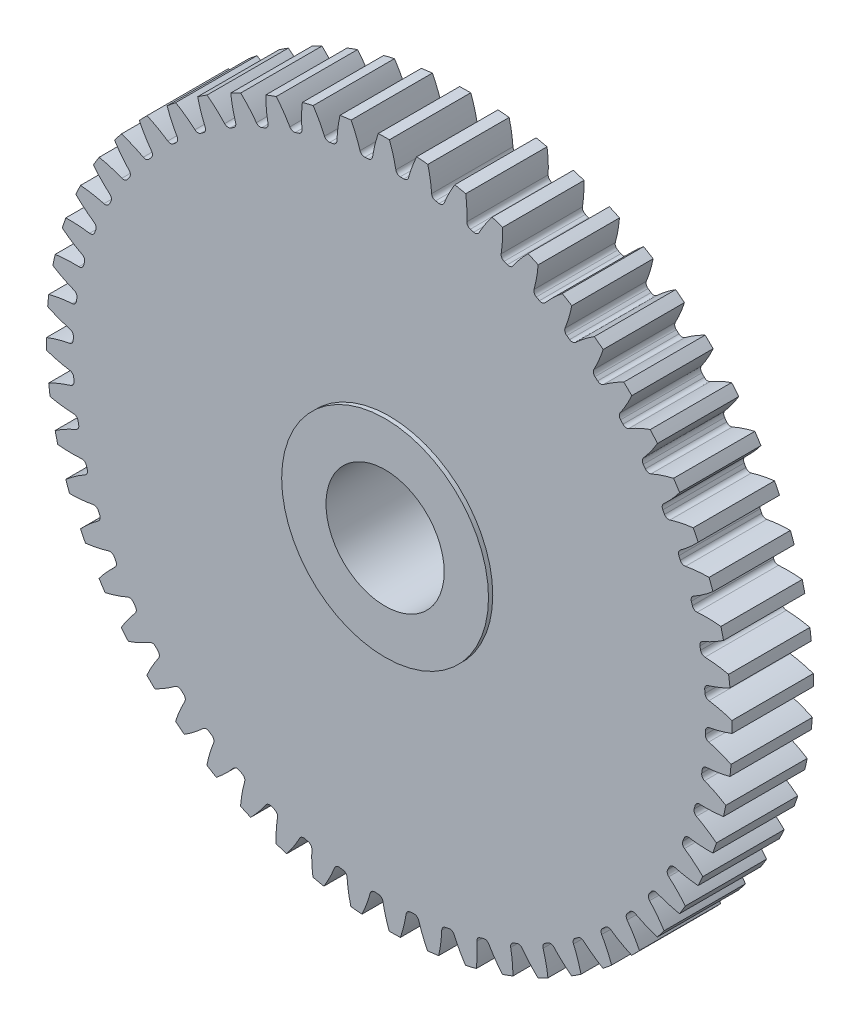
from build123d import *
from build123d.topology import SkipClean

# Parameters (mm, degrees)
SKETCH3_R           = 36.83
GEARBODY_DEPTH      = 8.7376
TOOTHCUT_DEPTH      = 53.81328861
CIRPATTERN1_COUNT   = 56
BOREDIA_R           = 6.35
BORE_DEPTH          = 12700
SKETCH4_R           = 11.1125
SKETCH4_R_2         = 6.35
BOSS_EXTRUDE1_DEPTH = 0.4572
BOSS_EXTRUDE2_START = 0.4572
SKETCH5_R           = 11.1125
SKETCH5_R_2         = 6.35
BOSS_EXTRUDE2_DEPTH = 0.4572


with BuildPart() as part:
    # Sketch3 → gearBody (new body)
    with BuildSketch(Plane.XY):
        Circle(SKETCH3_R)
    extrude(amount=GEARBODY_DEPTH)

    # Sketch2 → toothCut (cut, through all)
    with BuildSketch(Plane.XY):
        with BuildLine():
            ThreePointArc((33.949706813, -1.552812403), (33.957853024, -1.363098314), (33.964939104, -1.173341671))
            ThreePointArc((33.964939104, -1.173341671), (34.085641609, -0.864776515), (34.372974773, -0.699788022))
            ThreePointArc((34.372974773, -0.699788022), (39.510371111, 1.35349126), (43.46337325, 5.224223882))
            ThreePointArc((43.46337325, 5.224223882), (43.740993221, -1.755802232), (42.90479906, -8.691118859))
            ThreePointArc((42.90479906, -8.691118859), (39.274764673, -4.515996431), (34.318473101, -2.057547571))
            ThreePointArc((34.318473101, -2.057547571), (34.045288663, -1.870059404), (33.949706813, -1.552812403))
        make_face()
    toothcut = extrude(amount=TOOTHCUT_DEPTH, mode=Mode.SUBTRACT)

    # CirPattern1: toothCut ×56 about axis
    cirpattern1_axis = Axis((0, 0, 8.7376), (0, 0, -1))
    for i in range(1, CIRPATTERN1_COUNT):
        add(toothcut.rotate(cirpattern1_axis, i * 360 / CIRPATTERN1_COUNT), mode=Mode.SUBTRACT)

    # boreDia → bore (cut, symmetric)
    with BuildSketch(Plane.XY):
        Circle(BOREDIA_R)
    extrude(amount=BORE_DEPTH, both=True, mode=Mode.SUBTRACT)

    # Sketch4 → Boss-Extrude1 (add)
    with SkipClean():  # the faces are left unmerged after this step: merging them gives an invalid solid
        with BuildSketch(Plane(origin=(0, 0, 0), x_dir=(-1, 0, 0), z_dir=(0, 0, -1))):
            Circle(SKETCH4_R)
            Circle(SKETCH4_R_2, mode=Mode.SUBTRACT)
        extrude(amount=BOSS_EXTRUDE1_DEPTH)

    # Sketch5 → Boss-Extrude2 (add)
    with SkipClean():  # the faces are left unmerged after this step: merging them gives an invalid solid
        with BuildSketch(Plane.XY.offset(8.7376).offset(BOSS_EXTRUDE2_START)):
            Circle(SKETCH5_R)
            Circle(SKETCH5_R_2, mode=Mode.SUBTRACT)
        extrude(amount=-BOSS_EXTRUDE2_DEPTH)


solid = part.part
